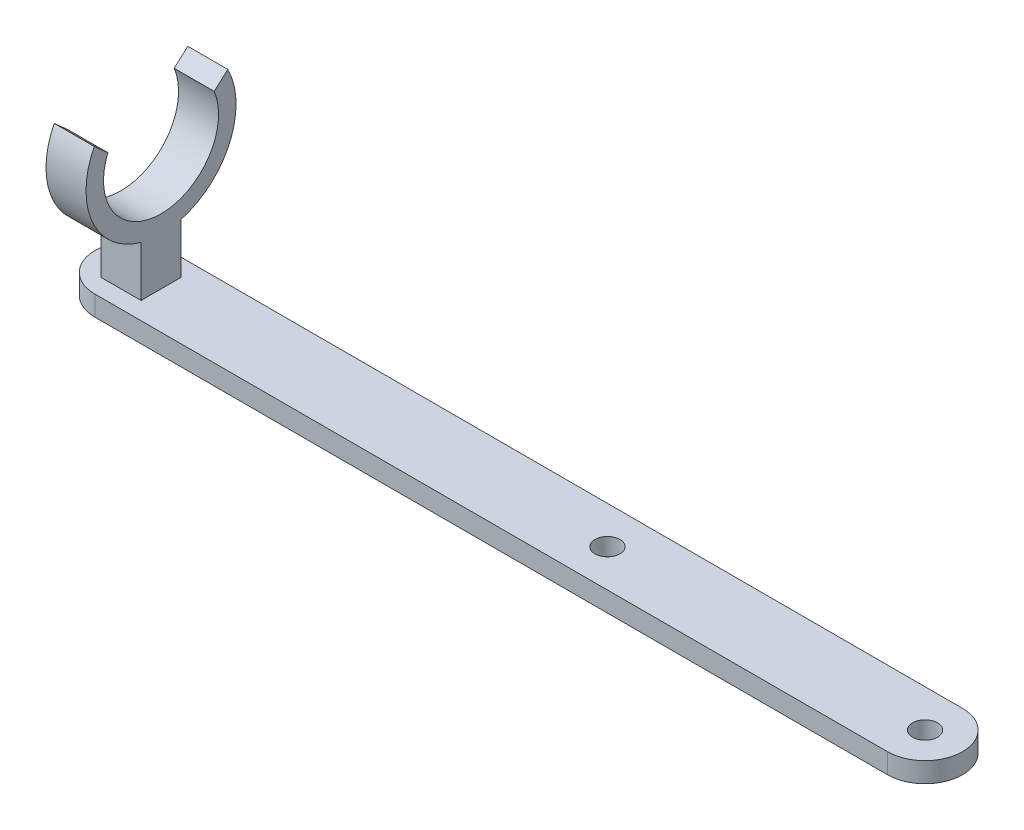
from build123d import *

# Parameters (mm, degrees)
SKETCH2_R                = 2.5
BOSS_EXTRUDE1_DEPTH      = 4
BOSS_EXTRUDE2_DEPTH      = 4
BOSS_EXTRUDE2_DEPTH_BACK = 4
BOSS_EXTRUDE3_REACH      = 140.673
BOSS_EXTRUDE3_END_RADIUS = 15
SKETCH4_W                = 8
SKETCH4_H                = 8
SKETCH5_R                = 5.4
CUT_EXTRUDE1_DEPTH       = 0.5


with BuildPart() as part:
    # Sketch2 → Boss-Extrude1 (new body)
    with BuildSketch(Plane(origin=(0, 0, 0), x_dir=(1, 0, 0), z_dir=(0, 1, 0))):
        with BuildLine():
            Line((-126.75, 7.5), (31.75, 7.5))
            ThreePointArc((31.75, 7.5), (39.25, 0), (31.75, -7.5))
            Line((31.75, -7.5), (-126.75, -7.5))
            ThreePointArc((-126.75, -7.5), (-134.25, 0), (-126.75, 7.5))
        make_face()
        with Locations((-31.75, 0)):
            Circle(SKETCH2_R, mode=Mode.SUBTRACT)
        with Locations((31.75, 0)):
            Circle(SKETCH2_R, mode=Mode.SUBTRACT)
    extrude(amount=BOSS_EXTRUDE1_DEPTH)



with BuildPart() as body_2:
    # Sketch3 → Boss-Extrude2 (new, two sides: drawn at the far end of the back side and taken through both)
    with BuildSketch(Plane(origin=(-125, 0, 0), x_dir=(0, 0, -1), z_dir=(1, 0, 0)).offset(-BOSS_EXTRUDE2_DEPTH_BACK)):
        with BuildLine():
            Line((-13.350700012, 35.338041326), (-10.624614624, 32.900859472))
            ThreePointArc((-10.624614624, 32.900859472), (0, 17), (10.624614624, 32.900859472))
            Line((10.624614624, 32.900859472), (13.350700012, 35.338041326))
            ThreePointArc((13.350700012, 35.338041326), (0, 13.5), (-13.350700012, 35.338041326))
        make_face()
    extrude(amount=BOSS_EXTRUDE2_DEPTH + BOSS_EXTRUDE2_DEPTH_BACK)


with BuildPart() as part_1:
    add(part.part)

    add(body_2.part)  # Boss-Extrude3 merges body 2
    # Boss-Extrude3: up to this cylinder (the profile starts outside it)
    boss_extrude3_end = Plane(origin=(-125, 28.5, 0), z_dir=(1, 0, 0)) * Cylinder(BOSS_EXTRUDE3_END_RADIUS, 312.346, mode=Mode.PRIVATE)
    # Sketch4 → Boss-Extrude3 (add, up to the surface)
    with BuildSketch(Plane(origin=(0, 4, 0), x_dir=(1, 0, 0), z_dir=(0, 1, 0)), mode=Mode.PRIVATE) as boss_extrude3_sk1:
        with Locations((-125, 0)):
            Rectangle(SKETCH4_W, SKETCH4_H)
    boss_extrude3_tool1 = extrude(boss_extrude3_sk1.sketch, amount=BOSS_EXTRUDE3_REACH, mode=Mode.PRIVATE) - boss_extrude3_end
    add(boss_extrude3_tool1.solids().sort_by_distance((-125, 4, 0))[0])

    # Sketch5 → Cut-Extrude1 (cut)
    with BuildSketch(Plane.XZ):
        with Locations((-31.75, 0)):
            Circle(SKETCH5_R)
        with Locations((31.75, 0)):
            Circle(SKETCH5_R)
    extrude(amount=-CUT_EXTRUDE1_DEPTH, mode=Mode.SUBTRACT)


solid = part_1.part
